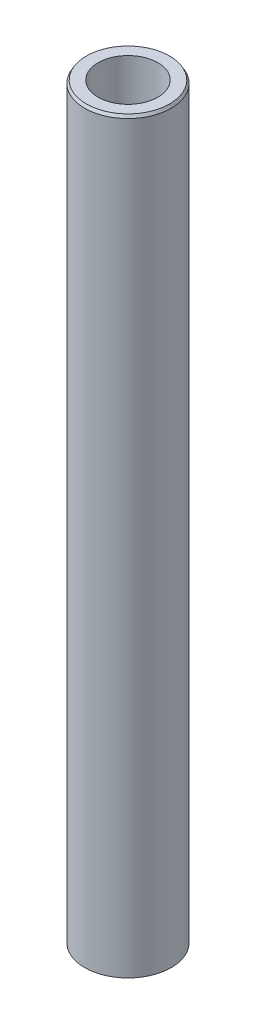
from build123d import *
from OCP.BRepFilletAPI import BRepFilletAPI_MakeChamfer

# Parameters (mm, degrees)
SKETCH1_R           = 25
BOSS_EXTRUDE1_DEPTH = 432.769714062
SKETCH2_R           = 17.277735565
CUT_EXTRUDE1_DEPTH  = 435.211498477
CHAMFER1_SIZE       = 1.663174884
CHAMFER1_SIZE2      = 0.960234467


with BuildPart() as part:
    # Sketch1 → Boss-Extrude1 (new body)
    with BuildSketch(Plane(origin=(0, 0, 0), x_dir=(1, 0, 0), z_dir=(0, 1, 0))):
        Circle(SKETCH1_R)
    extrude(amount=BOSS_EXTRUDE1_DEPTH)

    # Sketch2 → Cut-Extrude1 (cut, through all)
    with BuildSketch(Plane(origin=(0, 0, 0), x_dir=(1, 0, 0), z_dir=(0, 1, 0))):
        Circle(SKETCH2_R)
    extrude(amount=CUT_EXTRUDE1_DEPTH, mode=Mode.SUBTRACT)

    # Chamfer1: one chamfer whose edges measure the first distance from different faces: ONE call of the kernel's chamfer builder (chamfer() names one face for all edges)
    chamfer1_edges_1 = [part.edges().sort_by_distance(p)[0] for p in [
        (-25, 432.769714062, 0),
    ]]
    chamfer1_side_1 = [part.faces().sort_by_distance(p)[0] for p in [
        (-25, 216.384857031, 0),
    ]]
    chamfer1_edges_2 = [part.edges().sort_by_distance(p)[0] for p in [
        (-25, 0, 0),
    ]]
    chamfer1_side_2 = [part.faces().sort_by_distance(p)[0] for p in [
        (-24.292893219, 0, 0),
    ]]
    chamfer1 = BRepFilletAPI_MakeChamfer(part.part.solid().wrapped)
    for e in chamfer1_edges_1:
        chamfer1.Add(CHAMFER1_SIZE, CHAMFER1_SIZE2, e.wrapped, chamfer1_side_1[0].wrapped)  # the first distance lies on this face
    for e in chamfer1_edges_2:
        chamfer1.Add(CHAMFER1_SIZE, CHAMFER1_SIZE2, e.wrapped, chamfer1_side_2[0].wrapped)  # the first distance lies on this face
    add(Compound.cast(chamfer1.Shape()), mode=Mode.REPLACE)


solid = part.part
